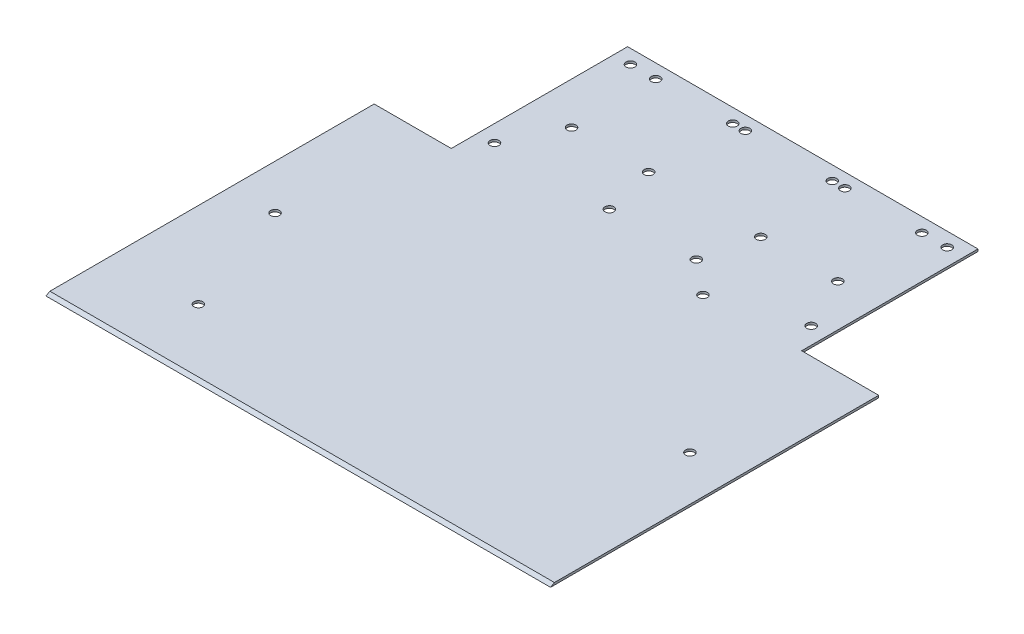
from build123d import *

# Parameters (mm, degrees)
SALIENTE_EXTRUIR1_DEPTH = 0.8
CORTAR_EXTRUIR1_REACH   = 203.248
CORTAR_EXTRUIR2_REACH   = 129.282
CROQUIS3_R              = 1.585
CORTAR_EXTRUIR3_REACH   = 129.282
CROQUIS4_R              = 1.585
CORTAR_EXTRUIR4_REACH   = 129.282
CROQUIS6_R              = 1.585
CORTAR_EXTRUIR5_REACH   = 129.282
CROQUIS7_R              = 1.585
CORTAR_EXTRUIR6_REACH   = 129.282
CROQUIS8_R              = 1.585


with BuildPart() as part:
    # Croquis1 → Saliente-Extruir1 (new body)
    with BuildSketch(Plane(origin=(0, 0, 0), x_dir=(1, 0, 0), z_dir=(0, 1, 0))):
        Polygon((-62.5, 90), (-62.5, 27.08), (-90, 27.08), (-90, -90), (90, -90), (90, 27.08), (62.5, 27.08), (62.5, 90), align=None)
    extrude(amount=SALIENTE_EXTRUIR1_DEPTH)

    # Croquis2 → Cortar-Extruir1 (cut, up to next)
    with BuildSketch(Plane.ZY.offset(90), mode=Mode.PRIVATE) as cortar_extruir1_sk1:
        Polygon((90, 0), (88.614359354, 0.8), (90, 0.8), align=None)
    cortar_extruir1_tool1 = extrude(cortar_extruir1_sk1.sketch, amount=-CORTAR_EXTRUIR1_REACH, mode=Mode.PRIVATE) & part.part
    add(cortar_extruir1_tool1.solids().sort_by_distance((-90, 0.533333, 89.53812))[0], mode=Mode.SUBTRACT)

    # Croquis3 → Cortar-Extruir2 (cut, up to next)
    with BuildSketch(Plane(origin=(0, 0.8, 0), x_dir=(1, 0, 0), z_dir=(0, 1, 0)), mode=Mode.PRIVATE) as cortar_extruir2_sk1:
        with Locations((74, -24.279339937)):
            Circle(CROQUIS3_R)
    cortar_extruir2_tool1 = extrude(cortar_extruir2_sk1.sketch, amount=-CORTAR_EXTRUIR2_REACH, mode=Mode.PRIVATE) & part.part
    cortar_extruir2 = cortar_extruir2_tool1.solids().sort_by_distance((74, 0.8, 24.27934))[0]
    add(cortar_extruir2, mode=Mode.SUBTRACT)

    # Simetría1: Cortar-Extruir2 across plane
    add(cortar_extruir2.mirror(Plane(origin=(0, 0, 0), x_dir=(0, 0, 1), z_dir=(1, 0, 0))), mode=Mode.SUBTRACT)

    # Croquis4 → Cortar-Extruir3 (cut, up to next)
    with BuildSketch(Plane(origin=(0, 0.8, 0), x_dir=(1, 0, 0), z_dir=(0, 1, 0)), mode=Mode.PRIVATE) as cortar_extruir3_sk1:
        with Locations((-56.5, 36.505640646)):
            Circle(CROQUIS4_R)
    cortar_extruir3_tool1 = extrude(cortar_extruir3_sk1.sketch, amount=-CORTAR_EXTRUIR3_REACH, mode=Mode.PRIVATE) & part.part
    # Croquis4 → Cortar-Extruir3 (cut, up to next)
    with BuildSketch(Plane(origin=(0, 0.8, 0), x_dir=(1, 0, 0), z_dir=(0, 1, 0)), mode=Mode.PRIVATE) as cortar_extruir3_sk2:
        with Locations((-15.5, 36.505640646)):
            Circle(CROQUIS4_R)
    cortar_extruir3_tool2 = extrude(cortar_extruir3_sk2.sketch, amount=-CORTAR_EXTRUIR3_REACH, mode=Mode.PRIVATE) & part.part
    # Croquis4 → Cortar-Extruir3 (cut, up to next)
    with BuildSketch(Plane(origin=(0, 0.8, 0), x_dir=(1, 0, 0), z_dir=(0, 1, 0)), mode=Mode.PRIVATE) as cortar_extruir3_sk3:
        with Locations((-15.5, 85.005640646)):
            Circle(CROQUIS4_R)
    cortar_extruir3_tool3 = extrude(cortar_extruir3_sk3.sketch, amount=-CORTAR_EXTRUIR3_REACH, mode=Mode.PRIVATE) & part.part
    # Croquis4 → Cortar-Extruir3 (cut, up to next)
    with BuildSketch(Plane(origin=(0, 0.8, 0), x_dir=(1, 0, 0), z_dir=(0, 1, 0)), mode=Mode.PRIVATE) as cortar_extruir3_sk4:
        with Locations((-56.5, 85.005640646)):
            Circle(CROQUIS4_R)
    cortar_extruir3_tool4 = extrude(cortar_extruir3_sk4.sketch, amount=-CORTAR_EXTRUIR3_REACH, mode=Mode.PRIVATE) & part.part
    add(cortar_extruir3_tool1.solids().sort_by_distance((-56.5, 0.8, -36.505641))[0], mode=Mode.SUBTRACT)
    add(cortar_extruir3_tool2.solids().sort_by_distance((-15.5, 0.8, -36.505641))[0], mode=Mode.SUBTRACT)
    add(cortar_extruir3_tool3.solids().sort_by_distance((-15.5, 0.8, -85.005641))[0], mode=Mode.SUBTRACT)
    add(cortar_extruir3_tool4.solids().sort_by_distance((-56.5, 0.8, -85.005641))[0], mode=Mode.SUBTRACT)

    # Croquis6 → Cortar-Extruir4 (cut, up to next)
    with BuildSketch(Plane(origin=(0, 0.8, 0), x_dir=(1, 0, 0), z_dir=(0, 1, 0)), mode=Mode.PRIVATE) as cortar_extruir4_sk1:
        with Locations((56.5, 85.005640646)):
            Circle(CROQUIS6_R)
    cortar_extruir4_tool1 = extrude(cortar_extruir4_sk1.sketch, amount=-CORTAR_EXTRUIR4_REACH, mode=Mode.PRIVATE) & part.part
    # Croquis6 → Cortar-Extruir4 (cut, up to next)
    with BuildSketch(Plane(origin=(0, 0.8, 0), x_dir=(1, 0, 0), z_dir=(0, 1, 0)), mode=Mode.PRIVATE) as cortar_extruir4_sk2:
        with Locations((15.5, 85.005640646)):
            Circle(CROQUIS6_R)
    cortar_extruir4_tool2 = extrude(cortar_extruir4_sk2.sketch, amount=-CORTAR_EXTRUIR4_REACH, mode=Mode.PRIVATE) & part.part
    # Croquis6 → Cortar-Extruir4 (cut, up to next)
    with BuildSketch(Plane(origin=(0, 0.8, 0), x_dir=(1, 0, 0), z_dir=(0, 1, 0)), mode=Mode.PRIVATE) as cortar_extruir4_sk3:
        with Locations((15.5, 36.505640646)):
            Circle(CROQUIS6_R)
    cortar_extruir4_tool3 = extrude(cortar_extruir4_sk3.sketch, amount=-CORTAR_EXTRUIR4_REACH, mode=Mode.PRIVATE) & part.part
    # Croquis6 → Cortar-Extruir4 (cut, up to next)
    with BuildSketch(Plane(origin=(0, 0.8, 0), x_dir=(1, 0, 0), z_dir=(0, 1, 0)), mode=Mode.PRIVATE) as cortar_extruir4_sk4:
        with Locations((56.5, 36.505640646)):
            Circle(CROQUIS6_R)
    cortar_extruir4_tool4 = extrude(cortar_extruir4_sk4.sketch, amount=-CORTAR_EXTRUIR4_REACH, mode=Mode.PRIVATE) & part.part
    add(cortar_extruir4_tool1.solids().sort_by_distance((56.5, 0.8, -85.005641))[0], mode=Mode.SUBTRACT)
    add(cortar_extruir4_tool2.solids().sort_by_distance((15.5, 0.8, -85.005641))[0], mode=Mode.SUBTRACT)
    add(cortar_extruir4_tool3.solids().sort_by_distance((15.5, 0.8, -36.505641))[0], mode=Mode.SUBTRACT)
    add(cortar_extruir4_tool4.solids().sort_by_distance((56.5, 0.8, -36.505641))[0], mode=Mode.SUBTRACT)

    # Croquis7 → Cortar-Extruir5 (cut, up to next)
    with BuildSketch(Plane(origin=(0, 0.8, 0), x_dir=(1, 0, 0), z_dir=(0, 1, 0)), mode=Mode.PRIVATE) as cortar_extruir5_sk1:
        with Locations((-20, 85.005640646)):
            Circle(CROQUIS7_R)
    cortar_extruir5_tool1 = extrude(cortar_extruir5_sk1.sketch, amount=-CORTAR_EXTRUIR5_REACH, mode=Mode.PRIVATE) & part.part
    # Croquis7 → Cortar-Extruir5 (cut, up to next)
    with BuildSketch(Plane(origin=(0, 0.8, 0), x_dir=(1, 0, 0), z_dir=(0, 1, 0)), mode=Mode.PRIVATE) as cortar_extruir5_sk2:
        with Locations((-47.5, 85.005640646)):
            Circle(CROQUIS7_R)
    cortar_extruir5_tool2 = extrude(cortar_extruir5_sk2.sketch, amount=-CORTAR_EXTRUIR5_REACH, mode=Mode.PRIVATE) & part.part
    # Croquis7 → Cortar-Extruir5 (cut, up to next)
    with BuildSketch(Plane(origin=(0, 0.8, 0), x_dir=(1, 0, 0), z_dir=(0, 1, 0)), mode=Mode.PRIVATE) as cortar_extruir5_sk3:
        with Locations((-47.5, 55.005640646)):
            Circle(CROQUIS7_R)
    cortar_extruir5_tool3 = extrude(cortar_extruir5_sk3.sketch, amount=-CORTAR_EXTRUIR5_REACH, mode=Mode.PRIVATE) & part.part
    # Croquis7 → Cortar-Extruir5 (cut, up to next)
    with BuildSketch(Plane(origin=(0, 0.8, 0), x_dir=(1, 0, 0), z_dir=(0, 1, 0)), mode=Mode.PRIVATE) as cortar_extruir5_sk4:
        with Locations((-20, 55.005640646)):
            Circle(CROQUIS7_R)
    cortar_extruir5_tool4 = extrude(cortar_extruir5_sk4.sketch, amount=-CORTAR_EXTRUIR5_REACH, mode=Mode.PRIVATE) & part.part
    cortar_extruir5_1 = cortar_extruir5_tool1.solids().sort_by_distance((-20, 0.8, -85.005641))[0]
    add(cortar_extruir5_1, mode=Mode.SUBTRACT)
    cortar_extruir5_2 = cortar_extruir5_tool2.solids().sort_by_distance((-47.5, 0.8, -85.005641))[0]
    add(cortar_extruir5_2, mode=Mode.SUBTRACT)
    cortar_extruir5_3 = cortar_extruir5_tool3.solids().sort_by_distance((-47.5, 0.8, -55.005641))[0]
    add(cortar_extruir5_3, mode=Mode.SUBTRACT)
    cortar_extruir5_4 = cortar_extruir5_tool4.solids().sort_by_distance((-20, 0.8, -55.005641))[0]
    add(cortar_extruir5_4, mode=Mode.SUBTRACT)
    cortar_extruir5 = cortar_extruir5_1 + cortar_extruir5_2 + cortar_extruir5_3 + cortar_extruir5_4  # Cortar-Extruir5 as one shape, for the pattern or mirror that repeats it

    # Simetría2: Cortar-Extruir5 across plane
    add(cortar_extruir5.mirror(Plane(origin=(0, 0, 0), x_dir=(0, 0, 1), z_dir=(1, 0, 0))), mode=Mode.SUBTRACT)

    # Croquis8 → Cortar-Extruir6 (cut, up to next)
    with BuildSketch(Plane(origin=(0, 0.8, 0), x_dir=(1, 0, 0), z_dir=(0, 1, 0)), mode=Mode.PRIVATE) as cortar_extruir6_sk1:
        with Locations((-59.479155942, -66.141846428)):
            Circle(CROQUIS8_R)
    cortar_extruir6_tool1 = extrude(cortar_extruir6_sk1.sketch, amount=-CORTAR_EXTRUIR6_REACH, mode=Mode.PRIVATE) & part.part
    # Croquis8 → Cortar-Extruir6 (cut, up to next)
    with BuildSketch(Plane(origin=(0, 0.8, 0), x_dir=(1, 0, 0), z_dir=(0, 1, 0)), mode=Mode.PRIVATE) as cortar_extruir6_sk2:
        with Locations((27.640844058, 26.738153572)):
            Circle(CROQUIS8_R)
    cortar_extruir6_tool2 = extrude(cortar_extruir6_sk2.sketch, amount=-CORTAR_EXTRUIR6_REACH, mode=Mode.PRIVATE) & part.part
    add(cortar_extruir6_tool1.solids().sort_by_distance((-59.479156, 0.8, 66.141846))[0], mode=Mode.SUBTRACT)
    add(cortar_extruir6_tool2.solids().sort_by_distance((27.640844, 0.8, -26.738154))[0], mode=Mode.SUBTRACT)


solid = part.part
